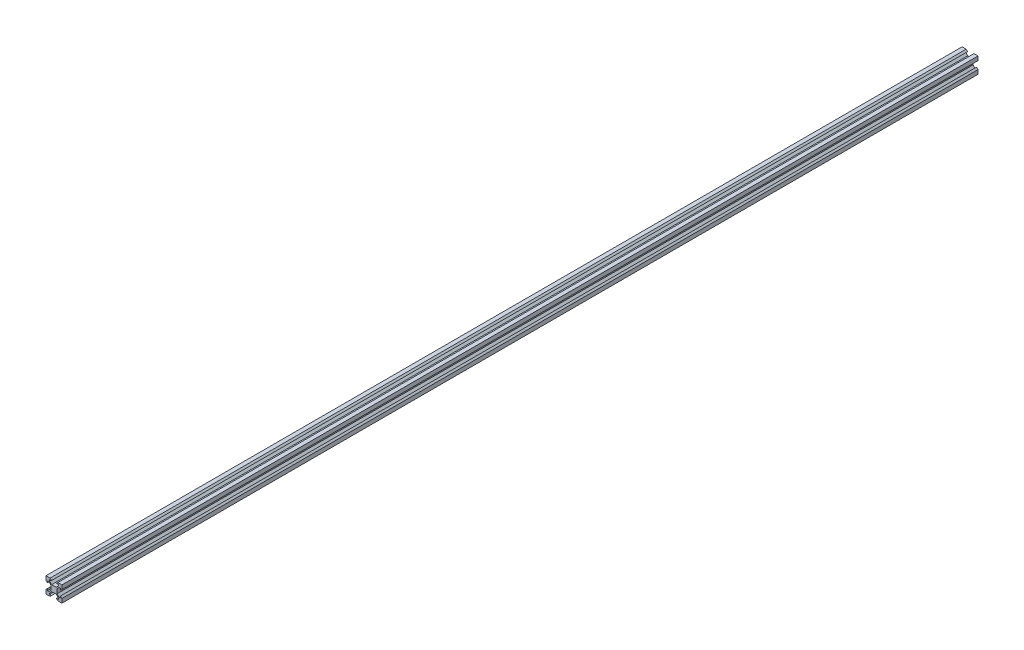
from build123d import *

# Parameters (mm, degrees)
SKETCH1_W           = 20
SKETCH1_H           = 20
BOSS_EXTRUDE1_DEPTH = 1153.3
CUT_EXTRUDE1_DEPTH  = 1154.646778698


with BuildPart() as part:
    # Sketch1 → Boss-Extrude1 (new body)
    with BuildSketch(Plane.XY):
        with Locations((10, 10)):
            Rectangle(SKETCH1_W, SKETCH1_H)
    extrude(amount=BOSS_EXTRUDE1_DEPTH)

    # Sketch2 → Cut-Extrude1 (cut, through all)
    with BuildSketch(Plane.XY.offset(1153.3)):
        Polygon((4.5, 18.18), (6.94, 18.18), (5.12, 20), (14.88, 20), (13.06, 18.18), (15.5, 18.18), (15.5, 16.475807358), (12.834192642, 13.81), (7.165807358, 13.81), (4.5, 16.475807358), align=None)
        Polygon((14.88, 0), (13.06, 1.82), (15.5, 1.82), (15.5, 3.524192642), (12.834192642, 6.19), (7.165807358, 6.19), (4.5, 3.524192642), (4.5, 1.82), (6.94, 1.82), (5.12, 0), align=None)
        Polygon((1.82, 4.5), (1.82, 6.94), (0, 5.12), (0, 14.88), (1.82, 13.06), (1.82, 15.5), (3.524192642, 15.5), (6.19, 12.834192642), (6.19, 7.165807358), (3.524192642, 4.5), align=None)
        Polygon((20, 14.88), (18.18, 13.06), (18.18, 15.5), (16.475807358, 15.5), (13.81, 12.834192642), (13.81, 7.165807358), (16.475807358, 4.5), (18.18, 4.5), (18.18, 6.94), (20, 5.12), align=None)
    extrude(amount=-CUT_EXTRUDE1_DEPTH, mode=Mode.SUBTRACT)


solid = part.part
